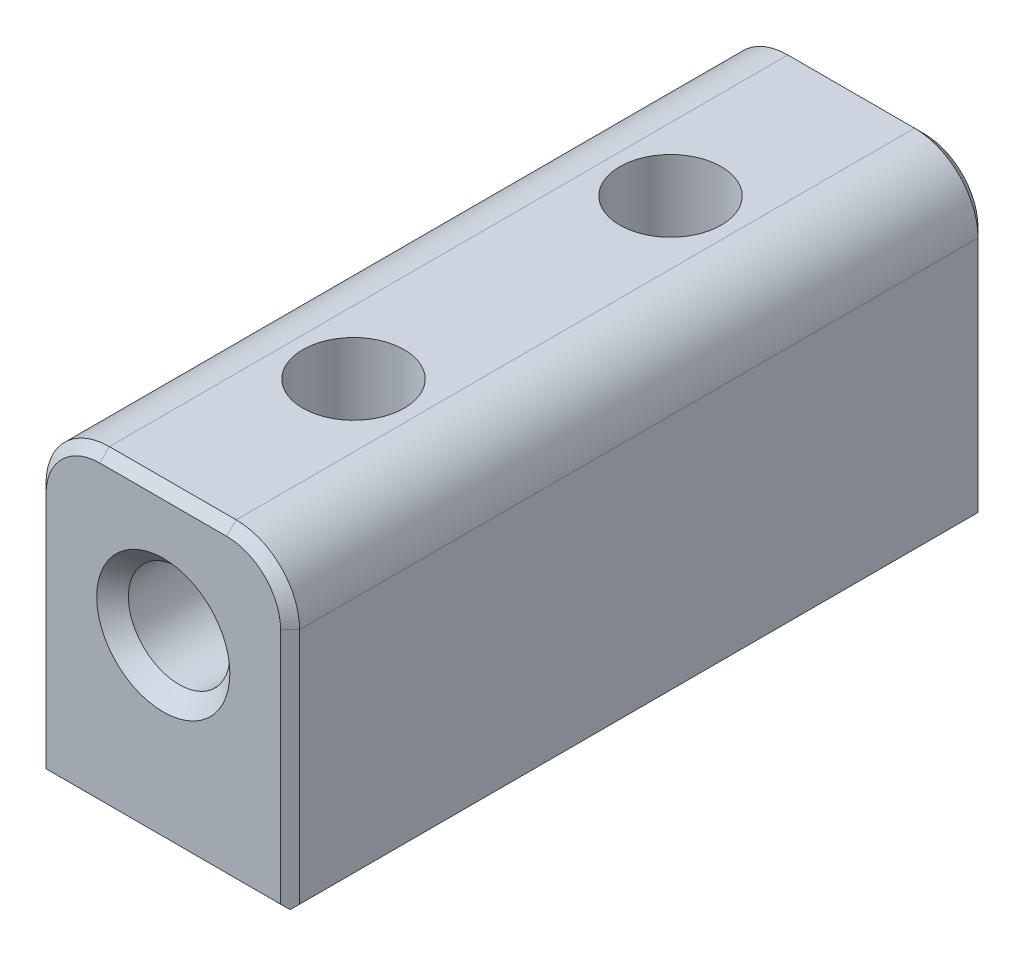
from build123d import *

# Parameters (mm, degrees)
SKETCH1_W           = 10.16
SKETCH1_H           = 27.94
SKETCH1_R           = 2.032
BOSS_EXTRUDE1_DEPTH = 12.7
SKETCH2_R           = 2.032
CUT_EXTRUDE1_DEPTH  = 3.81
CUT_EXTRUDE2_START  = -3.81
SKETCH4_R           = 2.032
CUT_EXTRUDE2_DEPTH  = 3.81
FILLET1_R           = 2.54
CHAMFER1_SIZE       = 0.635
CHAMFER2_SIZE       = 0.381


with BuildPart() as part:
    # Sketch1 → Boss-Extrude1 (new body)
    with BuildSketch(Plane(origin=(0, 0, 0), x_dir=(1, 0, 0), z_dir=(0, 1, 0))):
        Rectangle(SKETCH1_W, SKETCH1_H)
        with Locations((0, 6.35)):
            Circle(SKETCH1_R, mode=Mode.SUBTRACT)
        with Locations((0, -6.35)):
            Circle(SKETCH1_R, mode=Mode.SUBTRACT)
    extrude(amount=BOSS_EXTRUDE1_DEPTH)

    # Sketch2 → Cut-Extrude1 (cut)
    with BuildSketch(Plane.XY.offset(13.97)):
        with Locations((0, 7.62)):
            Circle(SKETCH2_R)
    extrude(amount=-CUT_EXTRUDE1_DEPTH, mode=Mode.SUBTRACT)

    # Sketch4 → Cut-Extrude2 (cut)
    with BuildSketch(Plane(origin=(0, 0, -13.97), x_dir=(-1, 0, 0), z_dir=(0, 0, -1)).offset(CUT_EXTRUDE2_START)):
        with Locations((0, 7.62)):
            Circle(SKETCH4_R)
    extrude(amount=CUT_EXTRUDE2_DEPTH, mode=Mode.SUBTRACT)

    # Fillet1
    fillet1_edges = [part.edges().sort_by_distance(p)[0] for p in [
        (5.08, 12.7, 0),
        (-5.08, 12.7, 0),
    ]]
    fillet(fillet1_edges, radius=FILLET1_R)

    # Chamfer1
    chamfer1_edges = [part.edges().sort_by_distance(p)[0] for p in [
        (-2.032, 0, 6.35),
        (-2.032, 0, -6.35),
        (0, 0, 13.97),
        (5.08, 0, 0),
        (0, 0, -13.97),
        (-5.08, 0, 0),
        (2.032, 7.62, -13.97),
        (-2.032, 7.62, 13.97),
    ]]
    chamfer(chamfer1_edges, length=CHAMFER1_SIZE)

    # Chamfer2
    chamfer2_edges = [part.edges().sort_by_distance(p)[0] for p in [
        (-5.08, 5.3975, -13.97),
        (-4.336051224, 11.956051224, -13.97),
        (0, 12.7, -13.97),
        (4.336051224, 11.956051224, -13.97),
        (5.08, 5.3975, -13.97),
        (-5.08, 5.3975, 13.97),
        (-4.336051224, 11.956051224, 13.97),
        (0, 12.7, 13.97),
        (4.336051224, 11.956051224, 13.97),
        (5.08, 5.3975, 13.97),
    ]]
    chamfer(chamfer2_edges, length=CHAMFER2_SIZE)


solid = part.part
